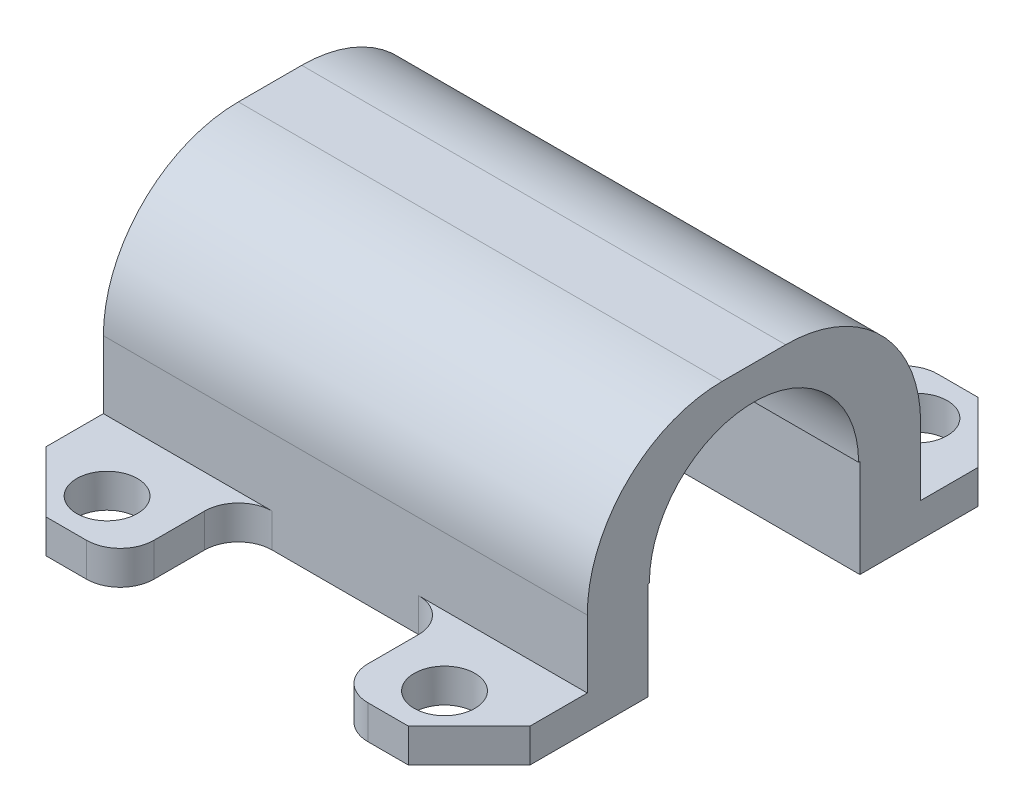
from build123d import *

# Parameters (mm, degrees)
BOSS_EXTRUDE1_DEPTH = 2.5
SKETCH2_R           = 0.9
CUT_EXTRUDE1_DEPTH  = 2.5
SKETCH3_W           = 14.34
SKETCH3_H           = 9.878404361
BOSS_EXTRUDE2_DEPTH = 4.5
SKETCH4_R           = 3.1
CUT_EXTRUDE2_DEPTH  = 57.133646482
SKETCH5_W           = 6.278404361
SKETCH5_H           = 2.9
CUT_EXTRUDE3_DEPTH  = 57.133646482
FILLET1_R           = 4
SKETCH7_W           = 6.34
SKETCH7_H           = 3.5
CUT_EXTRUDE5_DEPTH  = 61.145372561
FILLET2_R           = 1
SKETCH8_W           = 3.5
SKETCH8_H           = 1.5
CUT_EXTRUDE6_DEPTH  = 57.133646482


with BuildPart() as part:
    # Sketch1 → Boss-Extrude1 (new body)
    with BuildSketch(Plane(origin=(0, 0, 0), x_dir=(1, 0, 0), z_dir=(0, 1, 0))):
        Polygon((26.473858297, -52.017754202), (24.673858297, -53.817754202), (13.933858297, -53.817754202), (12.133858297, -52.017754202), (12.133858297, -38.739349841), (13.933858297, -36.939349841), (24.673858297, -36.939349841), (26.473858297, -38.739349841), align=None)
    extrude(amount=BOSS_EXTRUDE1_DEPTH)

    # Sketch2 → Cut-Extrude1 (cut)
    with BuildSketch(Plane(origin=(0, 2.5, 0), x_dir=(1, 0, 0), z_dir=(0, 1, 0))):
        with Locations((24.303858297, -52.377754202)):
            Circle(SKETCH2_R)
        with Locations((14.303858297, -52.377754202)):
            Circle(SKETCH2_R)
        with Locations((14.303858297, -38.379349841)):
            Circle(SKETCH2_R)
        with Locations((24.303858297, -38.379349841)):
            Circle(SKETCH2_R)
    extrude(amount=-CUT_EXTRUDE1_DEPTH, mode=Mode.SUBTRACT)

    # Sketch3 → Boss-Extrude2 (add)
    with BuildSketch(Plane(origin=(0, 2.5, 0), x_dir=(1, 0, 0), z_dir=(0, 1, 0))):
        with Locations((19.303858297, -45.378552021)):
            Rectangle(SKETCH3_W, SKETCH3_H)
    extrude(amount=BOSS_EXTRUDE2_DEPTH)

    # Sketch4 → Cut-Extrude2 (cut, through all)
    with BuildSketch(Plane.ZY.offset(-12.133858297)):
        with Locations((45.377754202, 2.9)):
            Circle(SKETCH4_R)
    extrude(amount=-CUT_EXTRUDE2_DEPTH, mode=Mode.SUBTRACT)

    # Sketch5 → Cut-Extrude3 (cut, through all)
    with BuildSketch(Plane.ZY.offset(-12.133858297)):
        with Locations((45.378552021, 1.45)):
            Rectangle(SKETCH5_W, SKETCH5_H)
    extrude(amount=-CUT_EXTRUDE3_DEPTH, mode=Mode.SUBTRACT)

    # Fillet1
    fillet1_edges = [part.edges().sort_by_distance(p)[0] for p in [
        (19.303858297, 7, 40.439349841),
        (19.303858297, 7, 50.317754202),
    ]]
    fillet(fillet1_edges, radius=FILLET1_R)

    # Sketch7 → Cut-Extrude5 (cut, through all)
    with BuildSketch(Plane(origin=(0, 2.5, 0), x_dir=(1, 0, 0), z_dir=(0, 1, 0))):
        with Locations((19.303858297, -52.067754202)):
            Rectangle(SKETCH7_W, SKETCH7_H)
        with Locations((19.303858297, -38.689349841)):
            Rectangle(SKETCH7_W, SKETCH7_H)
    extrude(amount=-CUT_EXTRUDE5_DEPTH, mode=Mode.SUBTRACT)

    # Fillet2
    fillet2_edges = [part.edges().sort_by_distance(p)[0] for p in [
        (16.133858297, 1.25, 50.317754202),
        (16.133858297, 1.25, 53.817754202),
        (22.473858297, 1.25, 50.317754202),
        (22.473858297, 1.25, 53.817754202),
        (22.473858297, 1.25, 40.439349841),
        (16.133858297, 1.25, 40.439349841),
        (16.133858297, 1.25, 36.939349841),
        (22.473858297, 1.25, 36.939349841),
    ]]
    fillet(fillet2_edges, radius=FILLET2_R)

    # Sketch8 → Cut-Extrude6 (cut, through all)
    with BuildSketch(Plane.ZY.offset(-12.133858297)):
        with Locations((38.689349841, 1.75)):
            Rectangle(SKETCH8_W, SKETCH8_H)
        with Locations((52.067754202, 1.75)):
            Rectangle(SKETCH8_W, SKETCH8_H)
    extrude(amount=-CUT_EXTRUDE6_DEPTH, mode=Mode.SUBTRACT)


solid = part.part
